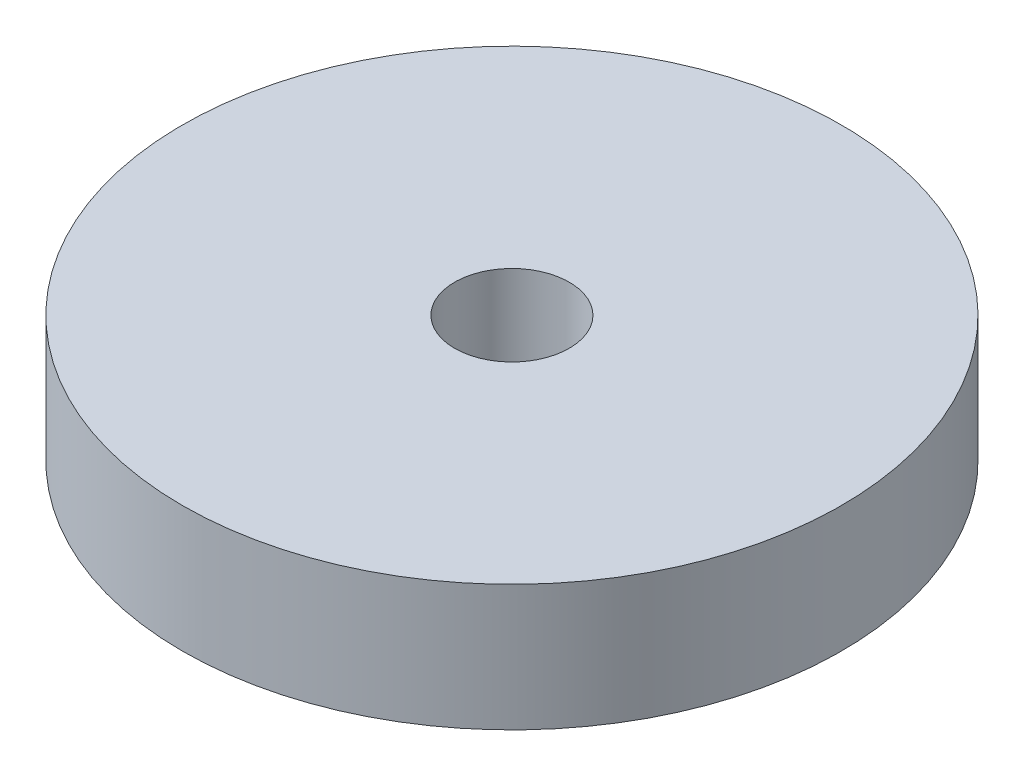
from build123d import *

# Parameters (mm, degrees)
SKETCH1_R           = 57.5
BOSS_EXTRUDE1_DEPTH = 22
SKETCH2_R           = 10
CUT_EXTRUDE1_DEPTH  = 85.240726493


with BuildPart() as part:
    # Sketch1 → Boss-Extrude1 (new body)
    with BuildSketch(Plane(origin=(0, 0, 0), x_dir=(1, 0, 0), z_dir=(0, 1, 0))):
        Circle(SKETCH1_R)
    extrude(amount=BOSS_EXTRUDE1_DEPTH)

    # Sketch2 → Cut-Extrude1 (cut, through all)
    with BuildSketch(Plane(origin=(0, 0, 0), x_dir=(1, 0, 0), z_dir=(0, 1, 0))):
        Circle(SKETCH2_R)
    extrude(amount=CUT_EXTRUDE1_DEPTH, mode=Mode.SUBTRACT)


solid = part.part
